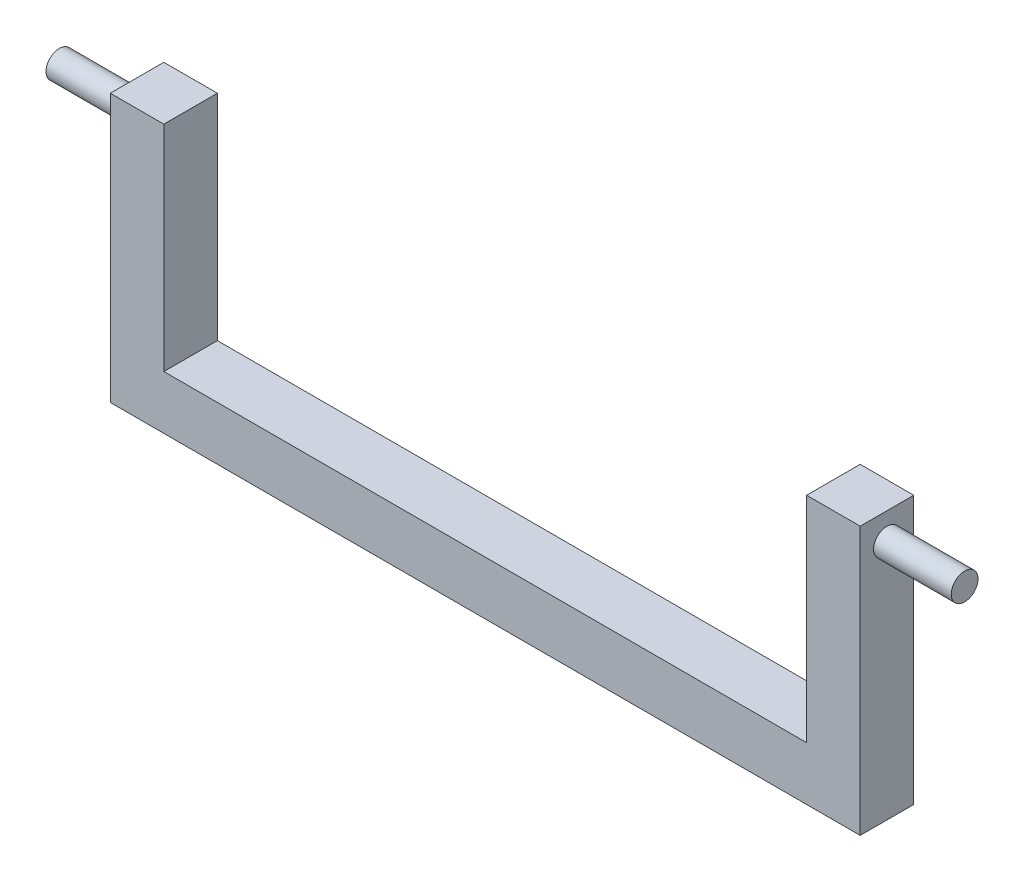
from build123d import *

# Parameters (mm, degrees)
BOSS_EXTRUDE1_DEPTH = 5
SKETCH2_R           = 2.5
BOSS_EXTRUDE2_DEPTH = 7.25
SKETCH3_R           = 2.5
BOSS_EXTRUDE3_DEPTH = 7.25


with BuildPart() as part:
    # Sketch1 → Boss-Extrude1 (new, symmetric)
    with BuildSketch(Plane.XY.offset(190)):
        Polygon((-70, 2), (70, 2), (70, 52), (60, 52), (60, 12), (-60, 12), (-60, 52), (-70, 52), align=None)
    extrude(amount=BOSS_EXTRUDE1_DEPTH, both=True)

    # Sketch2 → Boss-Extrude2 (add, symmetric)
    with BuildSketch(Plane(origin=(-77.25, 0, 0), x_dir=(0, 0, -1), z_dir=(1, 0, 0))):
        with Locations((-190, 47)):
            Circle(SKETCH2_R)
    extrude(amount=BOSS_EXTRUDE2_DEPTH, both=True)

    # Sketch3 → Boss-Extrude3 (add, symmetric)
    with BuildSketch(Plane(origin=(77.25, 0, 0), x_dir=(0, 0, -1), z_dir=(1, 0, 0))):
        with Locations((-190, 47)):
            Circle(SKETCH3_R)
    extrude(amount=BOSS_EXTRUDE3_DEPTH, both=True)


solid = part.part
